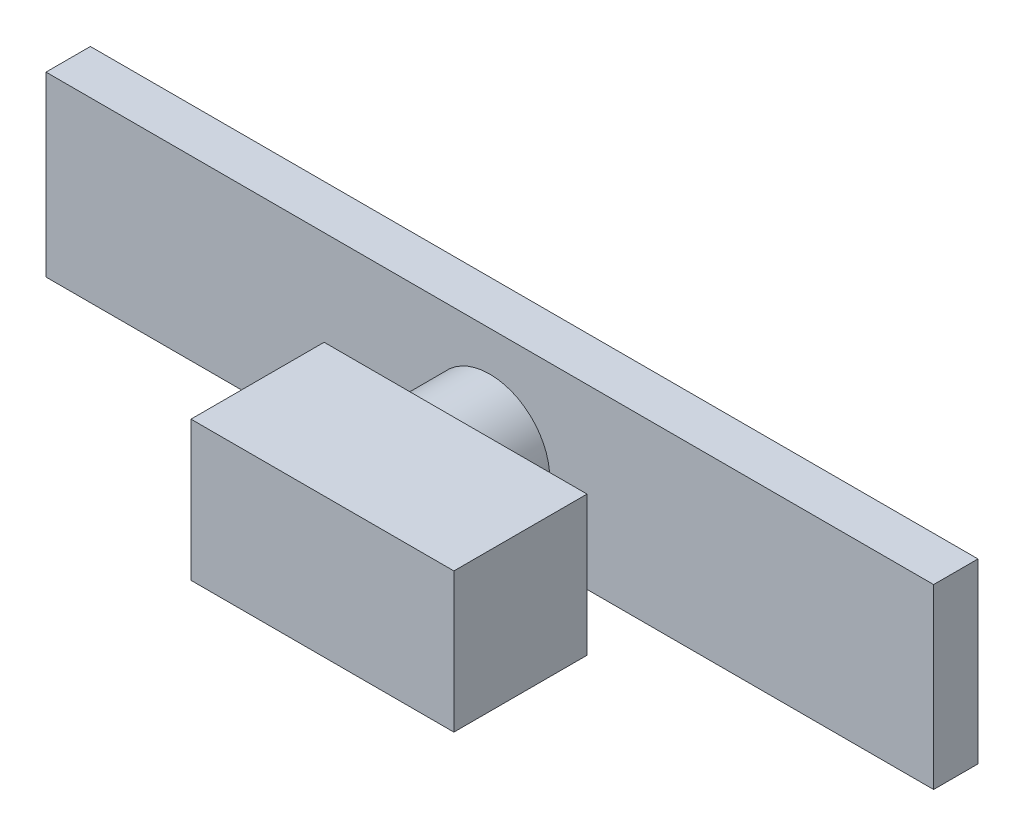
from build123d import *

# Parameters (mm, degrees)
SKETCH2_W             = 254
SKETCH2_H             = 12.7
BOSS_EXTRUDE1_DEPTH   = 50.8
SKETCH3_R             = 17.140791438
BOSS_EXTRUDE2_DEPTH   = 19.05
SKETCH4_W             = 75.235944222
SKETCH4_H             = 39.955088207
BOSS_EXTRUDE3_DEPTH   = 38.1
SCALE2_SCALE          = 0.06
BODY_MOVE_COPY1_ANGLE = 90
SCALE5_SCALE          = 0.25


with BuildPart() as part:
    # Sketch2 → Boss-Extrude1 (new body)
    with BuildSketch(Plane.XY):
        with Locations((79.130769231, 14.898076923)):
            Rectangle(SKETCH2_W, SKETCH2_H)
    extrude(amount=BOSS_EXTRUDE1_DEPTH)

    # Sketch3 → Boss-Extrude2 (add)
    with BuildSketch(Plane(origin=(0, 21.248076923, 0), x_dir=(1, 0, 0), z_dir=(0, 1, 0))):
        with Locations((79.130769231, -28.483063876)):
            Circle(SKETCH3_R)
    extrude(amount=BOSS_EXTRUDE2_DEPTH)

    # Sketch4 → Boss-Extrude3 (add)
    with BuildSketch(Plane(origin=(0, 40.298076923, 0), x_dir=(1, 0, 0), z_dir=(0, 1, 0))):
        with Locations((88.38546847, -28.088530296)):
            Rectangle(SKETCH4_W, SKETCH4_H)
    extrude(amount=BOSS_EXTRUDE3_DEPTH)


with BuildPart() as part_1:
    # Scale2: scaled about (82.711857342, 33.041003565, 26.623476887)
    add(part.part.scale(SCALE2_SCALE).moved(Location((77.749145901, 31.058543351, 25.026068274))))


with BuildPart() as part_2:
    # Body-Move/Copy1: moved
    add(part_1.part.rotate(Axis((0, 33.666927966, 26.550068274), (1, 0, 0)), BODY_MOVE_COPY1_ANGLE))


with BuildPart() as part_3:
    # Body-Move/Copy3: moved
    add(part_2.part.moved(Location((-50.8, 0, -50.8))))


with BuildPart() as part_4:
    # Scale5: scaled about (31.911857342, 33.593519353, -24.875856127)
    add(part_3.part.scale(SCALE5_SCALE).moved(Location((23.933893006, 25.195139515, -18.656892095))))


with BuildPart() as part_5:
    # Body-Move/Copy9: moved
    add(part_4.part.moved(Location((-50.8, 0, 0))))


solid = part_5.part
